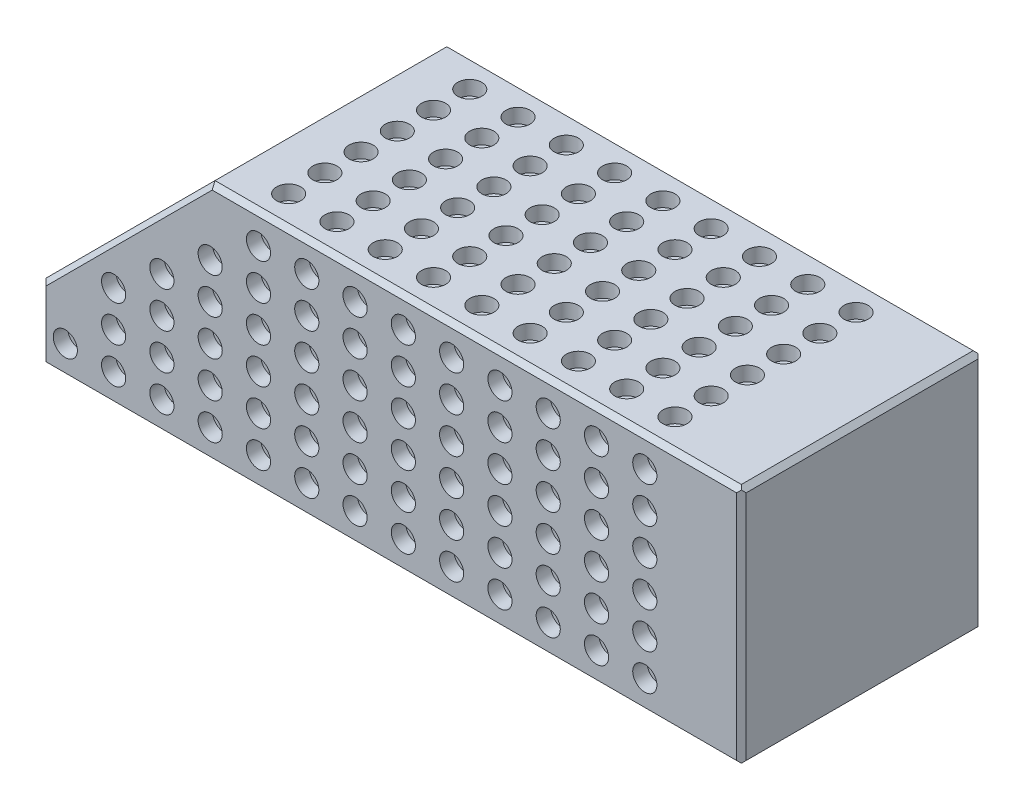
from build123d import *

# Parameters (mm, degrees)
SKETCH1_W                      = 145
SKETCH1_H                      = 50
BOSS_EXTRUDE1_DEPTH            = 25
CUT_EXTRUDE1_DEPTH             = 81.661329025
CUT_EXTRUDE1_DEPTH_BACK        = 81.661329025
F_12_0_12_DIAMETER_HOLE1_D     = 12
F_12_0_12_DIAMETER_HOLE1_DEPTH = 18
M10_TAPPED_HOLE2_D             = 8.5
M10_TAPPED_HOLE2_DEPTH         = 24.946342369
M10_TAPPED_HOLE2_TIP           = 2.553657631
CHAMFER1_SIZE                  = 1
CHAMFER2_SIZE                  = 1
CHAMFER3_SIZE                  = 1
SKETCH13_R                     = 2.5
CUT_EXTRUDE2_DEPTH             = 3
LPATTERN1_COUNT                = 6
LPATTERN1_PITCH                = 7.5
LPATTERN1_COUNT_DIR2           = 13
LPATTERN1_PITCH_DIR2           = 10
SKETCH14_R                     = 2.5
CUT_EXTRUDE3_DEPTH             = 3
LPATTERN2_COUNT                = 6
LPATTERN2_PITCH                = 7.5
LPATTERN2_COUNT_DIR2           = 13
LPATTERN2_PITCH_DIR2           = 10
SKETCH15_R                     = 2.5
CUT_EXTRUDE4_DEPTH             = 3
LPATTERN3_COUNT                = 6
LPATTERN3_PITCH                = 7.5
LPATTERN3_COUNT_DIR2           = 9
LPATTERN3_PITCH_DIR2           = 10
CUT_EXTRUDE5_START             = -3
SKETCH16_R                     = 2.5
CUT_EXTRUDE5_DEPTH             = 3
LPATTERN4_COUNT                = 13
LPATTERN4_PITCH                = 10
LPATTERN4_COUNT_DIR2           = 6
LPATTERN4_PITCH_DIR2           = 7.5
SKETCH17_R                     = 2.5
CUT_EXTRUDE6_DEPTH             = 3
LPATTERN5_COUNT                = 6
LPATTERN5_PITCH                = 7.5
LPATTERN5_COUNT_DIR2           = 6
LPATTERN5_PITCH_DIR2           = 7.5


with BuildPart() as part:
    # Sketch1 → Boss-Extrude1 (new, symmetric)
    with BuildSketch(Plane.XY):
        Rectangle(SKETCH1_W, SKETCH1_H)
    extrude(amount=BOSS_EXTRUDE1_DEPTH, both=True)

    # Sketch2 → Cut-Extrude1 (cut, two sides: drawn at the far end of the back side and taken through both)
    with BuildSketch(Plane.XY.offset(-CUT_EXTRUDE1_DEPTH_BACK)):
        Polygon((-72.5, -10), (-37.5, 25), (-72.5, 25), align=None)
    extrude(amount=CUT_EXTRUDE1_DEPTH + CUT_EXTRUDE1_DEPTH_BACK, mode=Mode.SUBTRACT)

    # Ø12.0 (12) Diameter Hole1
    with Locations(Plane.ZY.offset(72.5)):
        with Locations((0, -5)):
            Hole(F_12_0_12_DIAMETER_HOLE1_D / 2, depth=F_12_0_12_DIAMETER_HOLE1_DEPTH)

    # M10 Tapped Hole2
    with Locations(Plane.ZY.offset(54.5)):
        with Locations((0, -5)):
            Hole(M10_TAPPED_HOLE2_D / 2, depth=M10_TAPPED_HOLE2_DEPTH)
            with Locations((0, 0, -(M10_TAPPED_HOLE2_DEPTH + M10_TAPPED_HOLE2_TIP / 2))):  # 118° drill point
                Cone(0, M10_TAPPED_HOLE2_D / 2, M10_TAPPED_HOLE2_TIP, mode=Mode.SUBTRACT)

    # Chamfer1
    chamfer1_edges = [part.edges().sort_by_distance(p)[0] for p in [
        (-72.5, -17.5, -25),
        (0, -25, -25),
        (72.5, 0, -25),
        (17.5, 25, -25),
        (-55, 7.5, -25),
        (72.5, 0, 25),
        (0, -25, 25),
        (-72.5, -17.5, 25),
        (-55, 7.5, 25),
        (17.5, 25, 25),
    ]]
    chamfer(chamfer1_edges, length=CHAMFER1_SIZE)

    # Chamfer2
    chamfer2_edges = [part.edges().sort_by_distance(p)[0] for p in [
        (72.5, -25, 0),
        (72.5, 25, 0),
    ]]
    chamfer(chamfer2_edges, length=CHAMFER2_SIZE)

    # Chamfer3
    chamfer3_edges = [part.edges().sort_by_distance(p)[0] for p in [
        (-72.5, -25, 0),
    ]]
    chamfer(chamfer3_edges, length=CHAMFER3_SIZE)

    # Sketch13 → Cut-Extrude2 (cut)
    with BuildSketch(Plane.XZ.offset(25)):
        with Locations((-66.25, -18.75)):
            Circle(SKETCH13_R)
    cut_extrude2 = extrude(amount=-CUT_EXTRUDE2_DEPTH, mode=Mode.SUBTRACT)

    # LPattern1: Cut-Extrude2 6 × 13
    with Locations(*[(j * LPATTERN1_PITCH_DIR2, 0, i * LPATTERN1_PITCH) for i in range(LPATTERN1_COUNT) for j in range(LPATTERN1_COUNT_DIR2) if (i, j) != (0, 0)]):
        add(cut_extrude2, mode=Mode.SUBTRACT)

    # Sketch14 → Cut-Extrude3 (cut)
    with BuildSketch(Plane.XY.offset(25)):
        with Locations((52.5, 18.75)):
            Circle(SKETCH14_R)
    cut_extrude3 = extrude(amount=-CUT_EXTRUDE3_DEPTH, mode=Mode.SUBTRACT)

    # LPattern2: Cut-Extrude3 6 × 13, 11 skipped
    with Locations(*[(-j * LPATTERN2_PITCH_DIR2, -i * LPATTERN2_PITCH, 0) for i in range(LPATTERN2_COUNT) for j in range(LPATTERN2_COUNT_DIR2) if (i, j) not in ((0, 0), (0, 9), (0, 10), (0, 11), (0, 12), (1, 10), (1, 11), (1, 12), (2, 11), (2, 12), (3, 12), (4, 12))]):
        add(cut_extrude3, mode=Mode.SUBTRACT)

    # Sketch15 → Cut-Extrude4 (cut)
    with BuildSketch(Plane(origin=(0, 25, 0), x_dir=(1, 0, 0), z_dir=(0, 1, 0))):
        with Locations((52.5, 18.75)):
            Circle(SKETCH15_R)
    cut_extrude4 = extrude(amount=-CUT_EXTRUDE4_DEPTH, mode=Mode.SUBTRACT)

    # LPattern3: Cut-Extrude4 6 × 9
    with Locations(*[(-j * LPATTERN3_PITCH_DIR2, 0, i * LPATTERN3_PITCH) for i in range(LPATTERN3_COUNT) for j in range(LPATTERN3_COUNT_DIR2) if (i, j) != (0, 0)]):
        add(cut_extrude4, mode=Mode.SUBTRACT)

    # Sketch16 → Cut-Extrude5 (cut)
    with BuildSketch(Plane(origin=(0, 0, -25), x_dir=(-1, 0, 0), z_dir=(0, 0, -1)).offset(CUT_EXTRUDE5_START)):
        with Locations((-52.5, 18.75)):
            Circle(SKETCH16_R)
    cut_extrude5 = extrude(amount=CUT_EXTRUDE5_DEPTH, mode=Mode.SUBTRACT)

    # LPattern4: Cut-Extrude5 13 × 6, 11 skipped
    with Locations(*[(-i * LPATTERN4_PITCH, -j * LPATTERN4_PITCH_DIR2, 0) for i in range(LPATTERN4_COUNT) for j in range(LPATTERN4_COUNT_DIR2) if (i, j) not in ((0, 0), (9, 0), (10, 0), (10, 1), (11, 0), (11, 1), (11, 2), (12, 0), (12, 1), (12, 2), (12, 3), (12, 4))]):
        add(cut_extrude5, mode=Mode.SUBTRACT)

    # Sketch17 → Cut-Extrude6 (cut)
    with BuildSketch(Plane(origin=(-31.25, 31.25, 0), x_dir=(0, 0, 1), z_dir=(-0.7071067811865515, 0.7071067811865436, 0))):
        with Locations((-18.75, -16.338834765)):
            Circle(SKETCH17_R)
    cut_extrude6 = extrude(amount=-CUT_EXTRUDE6_DEPTH, mode=Mode.SUBTRACT)

    # LPattern5: Cut-Extrude6 6 × 6, 12 skipped
    with Locations(*[Vector(0, 0, 1) * (i * LPATTERN5_PITCH) + Vector(-0.7071067811865436, -0.7071067811865515, 0) * (j * LPATTERN5_PITCH_DIR2) for i in range(LPATTERN5_COUNT) for j in range(LPATTERN5_COUNT_DIR2) if (i, j) not in ((0, 0), (2, 0), (2, 1), (2, 2), (2, 3), (2, 4), (2, 5), (3, 0), (3, 1), (3, 2), (3, 3), (3, 4), (3, 5))]):
        add(cut_extrude6, mode=Mode.SUBTRACT)


solid = part.part
